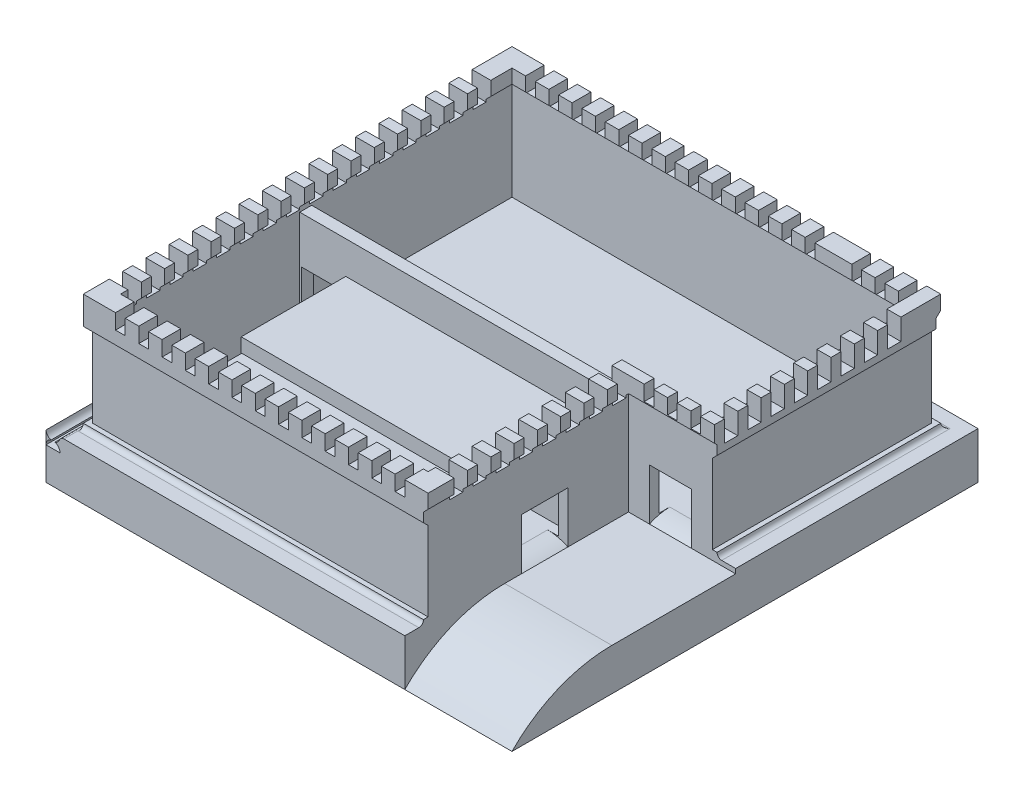
from build123d import *

# Parameters (mm, degrees)
SKETCH1_W                 = 100
SKETCH1_H                 = 100
BOSS_EXTRUDE1_DEPTH       = 10
BOSS_EXTRUDE2_DEPTH       = 20
CUT_EXTRUDE1_START        = -100
CUT_EXTRUDE1_DEPTH        = 100
CUT_EXTRUDE1_START_2      = -101
CUT_EXTRUDE1_2_DEPTH      = 102
SKETCH5_W                 = 9
SKETCH5_H                 = 10
CUT_EXTRUDE2_DEPTH        = 20
SKETCH6_W                 = 10
SKETCH6_H                 = 10
CUT_EXTRUDE3_DEPTH        = 20
BOSS_EXTRUDE3_DEPTH       = 1
FILLET1_R                 = 1
SKETCH8_W                 = 23
SKETCH8_H                 = 48
CUT_EXTRUDE4_DEPTH        = 1
FILLET2_R                 = 30
FILLET3_START             = 31.5
FILLET3_DEPTH             = 9
FILLET3_START_2           = 33.91668
FILLET3_2_DEPTH           = 9.08332
FILLET3_START_3           = 15
FILLET3_3_DEPTH           = 10
FILLET3_4_DEPTH           = 28
BOSS_EXTRUDE4_DEPTH       = 5
CHAMFER1_SIZE             = 2
CHAMFER2_SIZE             = 2
CHAMFER3_SIZE             = 2
CHAMFER4_SIZE             = 2
CUT_EXTRUDE5_DEPTH        = 114.758517518
CUT_EXTRUDE5_DEPTH_BACK   = 114.758517518
SKETCH11_W                = 2.088138395
SKETCH11_H                = 3.24599204
CUT_EXTRUDE6_DEPTH        = 114.758516165
CUT_EXTRUDE6_DEPTH_BACK   = 114.758516165
SKETCH12_W                = 2.852535489
SKETCH12_H                = 4.538038875
CUT_EXTRUDE7_DEPTH        = 114.758517518
CUT_EXTRUDE7_DEPTH_BACK   = 114.758517518
SKETCH13_W                = 2.088138395
SKETCH13_H                = 3.24599204
SKETCH14_W                = 68.165894697
SKETCH14_H                = 2.552820194
BOSS_EXTRUDE5_DEPTH       = 20
SKETCH15_W                = 10
SKETCH15_H                = 10
CUT_EXTRUDE8_DEPTH        = 20
EXTRUDE_THIN1_START       = -0.282202113
EXTRUDE_THIN1_OUTLINE_W   = 26.615026424
EXTRUDE_THIN1_OUTLINE_H   = 9
EXTRUDE_THIN1_OUTLINE_W_2 = 14
EXTRUDE_THIN1_DEPTH       = 10.282202113
SKETCH17_W                = 58.115026424
SKETCH17_H                = 22.447179806
BOSS_EXTRUDE6_DEPTH       = 3


with BuildPart() as part:
    # Sketch1 → Boss-Extrude1 (new body)
    with BuildSketch(Plane(origin=(0, 0, 0), x_dir=(1, 0, 0), z_dir=(0, 1, 0))):
        Rectangle(SKETCH1_W, SKETCH1_H)
    extrude(amount=BOSS_EXTRUDE1_DEPTH)

    # Sketch2 → Boss-Extrude2 (add)
    with BuildSketch(Plane(origin=(0, 10, 0), x_dir=(1, 0, 0), z_dir=(0, 1, 0))):
        Polygon((43, -2), (45, -2), (45, 0), (45, 45), (-45, 45), (-45, -45), (25, -45), (27, -45), (27, -43), (27, -2), align=None)
        Polygon((-43, 43), (43, 43), (43, 0), (25, 0), (25, -43), (-43, -43), align=None, mode=Mode.SUBTRACT)
    extrude(amount=BOSS_EXTRUDE2_DEPTH)

    # Cut-Extrude1 2 outline → Cut-Extrude1 2 (cut)
    with BuildSketch(Plane.XY.offset(50).offset(CUT_EXTRUDE1_START_2)):
        with BuildLine():
            ThreePointArc((-48.08454022, 8.427966545), (-47.26102105, 9.019950559), (-47, 10))
            Line((-47, 10), (-50, 10))
            Line((-50, 10), (-50, 6.983607237))
            Line((-50, 6.983607237), (-47, 6.983607237))
            ThreePointArc((-47, 6.983607237), (-47.300504275, 7.887323972), (-48.08454022, 8.427966545))
        make_face()
    extrude(amount=CUT_EXTRUDE1_2_DEPTH, mode=Mode.SUBTRACT)

    # Sketch5 → Cut-Extrude2 (cut)
    with BuildSketch(Plane.XY.offset(2)):
        with Locations((36, 15)):
            Rectangle(SKETCH5_W, SKETCH5_H)
    extrude(amount=-CUT_EXTRUDE2_DEPTH, mode=Mode.SUBTRACT)

    # Sketch6 → Cut-Extrude3 (cut)
    with BuildSketch(Plane(origin=(27, 0, 0), x_dir=(0, 0, -1), z_dir=(1, 0, 0))):
        with Locations((-20, 15)):
            Rectangle(SKETCH6_W, SKETCH6_H)
    extrude(amount=-CUT_EXTRUDE3_DEPTH, mode=Mode.SUBTRACT)

    # Sketch7 → Boss-Extrude3 (add)
    with BuildSketch(Plane(origin=(0, 10, 0), x_dir=(1, 0, 0), z_dir=(0, 1, 0))):
        Polygon((27, -46), (27, -45), (-45, -45), (-45, 45), (45, 45), (45, -2), (46, -2), (46, 46), (-46, 46), (-46, -46), align=None)
    extrude(amount=BOSS_EXTRUDE3_DEPTH)

    # Fillet1
    fillet1_edges = [part.edges().sort_by_distance(p)[0] for p in [
        (46, 10, -22),
        (0, 10, -46),
        (-47, 10, 0),
        (-9.5, 10, 46),
    ]]
    fillet(fillet1_edges, radius=FILLET1_R - 0.0001)  # a hair under: the kernel refuses the full size

    # Sketch8 → Cut-Extrude4 (cut)
    with BuildSketch(Plane(origin=(0, 10, 0), x_dir=(1, 0, 0), z_dir=(0, 1, 0))):
        with Locations((38.5, -26)):
            Rectangle(SKETCH8_W, SKETCH8_H)
    extrude(amount=-CUT_EXTRUDE4_DEPTH, mode=Mode.SUBTRACT)

    # Fillet2
    # the kernel refuses this fillet: 30 mm, written as the material it takes off along each edge
    with BuildSketch(Plane(origin=(103.560713214, 9, 50), x_dir=(0, -1, 0), z_dir=(-1, 0, 0))) as fillet2_piece_1:
        with BuildLine():
            CenterArc((30, -21.424285286), FILLET2_R, 134.427004001, 45.572995999)
            Line((0, -21.424285286), (-0.6, -21.424285286))
            Line((-0.6, -21.424285286), (-0.6, 0))
            Line((-0.6, 0), (0, 0.6))
            ThreePointArc((0, 0.6), (4.5, 0.6), (8.58, 0.428485706))
            Line((8.58, 0.428485706), (9, 0))
        make_face()
    extrude(amount=76.560713214, mode=Mode.SUBTRACT)

    # Fillet3: read off the stored shape, not the designer's step
    # Fillet3 outline → Fillet3 (cut)
    with BuildSketch(Plane.YZ.offset(FILLET3_START)):
        with BuildLine():
            Line((10, 2), (9, 2))
            ThreePointArc((9, 2), (9.746794345, -0.122830966), (10, -2.358898944))
            Line((10, -2.358898944), (10, 2))
        make_face()
    extrude(amount=FILLET3_DEPTH, mode=Mode.SUBTRACT)

    # Fillet3 2 outline → Fillet3 2 (cut)
    with BuildSketch(Plane.YZ.offset(FILLET3_START_2)):
        with BuildLine():
            Line((10, 0), (9.717797887, 0))
            ThreePointArc((9.717797887, 0), (9.929198832, -1.171039287), (10, -2.358898944))
            Line((10, -2.358898944), (10, 0))
        make_face()
    extrude(amount=FILLET3_2_DEPTH, mode=Mode.SUBTRACT)

    # Fillet3 3 outline → Fillet3 3 (cut)
    with BuildSketch(Plane.XY.offset(FILLET3_START_3)):
        with BuildLine():
            Line((27, 9), (27, 10))
            Line((27, 10), (22.641101056, 10))
            ThreePointArc((22.641101056, 10), (24.877169034, 9.746794345), (27, 9))
        make_face()
    extrude(amount=FILLET3_3_DEPTH, mode=Mode.SUBTRACT)

    # Fillet3 4 outline → Fillet3 4 (cut)
    with BuildSketch(Plane.XY.offset(FILLET3_START_3)):
        with BuildLine():
            ThreePointArc((22.641101056, 10), (23.828960713, 9.929198832), (25, 9.717797887))
            Line((25, 9.717797887), (25, 10))
            Line((25, 10), (22.641101056, 10))
        make_face()
    extrude(amount=FILLET3_4_DEPTH, mode=Mode.SUBTRACT)

    # Sketch10 → Boss-Extrude4 (add)
    with BuildSketch(Plane(origin=(0, 30, 0), x_dir=(1, 0, 0), z_dir=(0, 1, 0))):
        Polygon((28, -3), (46, -3), (46, 46), (-46, 46), (-46, -46), (28, -46), align=None)
        Polygon((24, 1), (42, 1), (42, 42), (-42, 42), (-42, -42), (24, -42), align=None, mode=Mode.SUBTRACT)
    extrude(amount=BOSS_EXTRUDE4_DEPTH)

    # Chamfer1
    # the kernel refuses this chamfer: 2 mm, written as the material it adds along each edge
    with BuildSketch(Plane(origin=(-45, 30, -45), x_dir=(-1, 0, 0), z_dir=(0, 0, 1))) as chamfer1_piece_1_section:
        Polygon((CHAMFER1_SIZE, 0), (0, CHAMFER1_SIZE), (0, 0), align=None)
    chamfer1_piece_1 = extrude(amount=90, mode=Mode.PRIVATE)
    chamfer1_piece_1 = split(chamfer1_piece_1, bisect_by=Plane(origin=(-46, 30, -45), z_dir=(1, 0, 0)), keep=Keep.TOP, mode=Mode.PRIVATE)
    add(chamfer1_piece_1)
    with BuildSketch(Plane(origin=(27, 30, 45), x_dir=(0, 0, 1), z_dir=(-1, 0, 0))) as chamfer1_piece_2_section:
        Polygon((CHAMFER1_SIZE, 0), (0, -CHAMFER1_SIZE), (0, 0), align=None)
    chamfer1_piece_2 = extrude(amount=72, mode=Mode.PRIVATE)
    chamfer1_piece_2 = split(chamfer1_piece_2, bisect_by=Plane(origin=(27, 30, 46), z_dir=(0, 0, -1)), keep=Keep.TOP, mode=Mode.PRIVATE)
    add(chamfer1_piece_2)
    with BuildSketch(Plane(origin=(45, 30, -45), x_dir=(1, 0, 0), z_dir=(0, 0, 1))) as chamfer1_piece_3_section:
        Polygon((CHAMFER1_SIZE, 0), (0, -CHAMFER1_SIZE), (0, 0), align=None)
    chamfer1_piece_3 = extrude(amount=47, mode=Mode.PRIVATE)
    chamfer1_piece_3 = split(chamfer1_piece_3, bisect_by=Plane(origin=(46, 30, -45), z_dir=(-1, 0, 0)), keep=Keep.TOP, mode=Mode.PRIVATE)
    add(chamfer1_piece_3)
    with BuildSketch(Plane(origin=(-45, 30, -45), x_dir=(-1, 0, 0), z_dir=(0, 0, 1))) as chamfer1_piece_4a_section:
        Polygon((CHAMFER1_SIZE, 0), (0, CHAMFER1_SIZE), (0, 0), align=None)
    chamfer1_piece_4a = extrude(amount=95.143365976, mode=Mode.PRIVATE)
    chamfer1_piece_4a = split(chamfer1_piece_4a, bisect_by=Plane(origin=(-45, 30, 46), z_dir=(0, 0, -1)), keep=Keep.TOP, mode=Mode.PRIVATE)
    chamfer1_piece_4a = split(chamfer1_piece_4a, bisect_by=Plane(origin=(-46, 30, -45), z_dir=(1, 0, 0)), keep=Keep.TOP, mode=Mode.PRIVATE)
    chamfer1_piece_4a = split(chamfer1_piece_4a, bisect_by=Plane(origin=(-45, 30, 45), z_dir=(0, 0, 1)), keep=Keep.TOP, mode=Mode.PRIVATE)
    with BuildSketch(Plane(origin=(27, 30, 45), x_dir=(0, 0, 1), z_dir=(-1, 0, 0))) as chamfer1_piece_4b_section:
        Polygon((CHAMFER1_SIZE, 0), (0, -CHAMFER1_SIZE), (0, 0), align=None)
    chamfer1_piece_4b = extrude(amount=77.143365976, mode=Mode.PRIVATE)
    chamfer1_piece_4b = split(chamfer1_piece_4b, bisect_by=Plane(origin=(27, 30, 46), z_dir=(0, 0, -1)), keep=Keep.TOP, mode=Mode.PRIVATE)
    chamfer1_piece_4b = split(chamfer1_piece_4b, bisect_by=Plane(origin=(-46, 30, 45), z_dir=(1, 0, 0)), keep=Keep.TOP, mode=Mode.PRIVATE)
    chamfer1_piece_4b = split(chamfer1_piece_4b, bisect_by=Plane(origin=(-45, 30, 45), z_dir=(-1, 0, 0)), keep=Keep.TOP, mode=Mode.PRIVATE)
    chamfer1_piece_4 = chamfer1_piece_4a & chamfer1_piece_4b
    add(chamfer1_piece_4)

    # Chamfer2
    # the kernel refuses this chamfer: 2 mm, written as the material it takes off along each edge
    with BuildSketch(Plane(origin=(51.143365976, 30, -46), x_dir=(0, 1, 0), z_dir=(-1, 0, 0))) as chamfer2_piece_1_section:
        Polygon((CHAMFER2_SIZE, 0), (0, -CHAMFER2_SIZE), (0, 0), align=None)
    chamfer2_piece_1 = extrude(amount=102.286731952, mode=Mode.PRIVATE)
    chamfer2_piece_1 = split(chamfer2_piece_1, bisect_by=Plane(origin=(51.143365976, 30, -45), z_dir=(0, 0, -1)), keep=Keep.TOP, mode=Mode.PRIVATE)
    add(chamfer2_piece_1, mode=Mode.SUBTRACT)
    with BuildSketch(Plane(origin=(28, 30, 3), x_dir=(0, 1, 0), z_dir=(1, 0, 0))) as chamfer2_piece_2_section:
        Polygon((CHAMFER2_SIZE, 0), (0, -CHAMFER2_SIZE), (0, 0), align=None)
    chamfer2_piece_2 = extrude(amount=23.143365976, mode=Mode.PRIVATE)
    chamfer2_piece_2 = split(chamfer2_piece_2, bisect_by=Plane(origin=(28, 30, 2), z_dir=(0, 0, 1)), keep=Keep.TOP, mode=Mode.PRIVATE)
    add(chamfer2_piece_2, mode=Mode.SUBTRACT)
    with BuildSketch(Plane(origin=(28, 30, 51.143365976), x_dir=(-1, 0, 0), z_dir=(0, 0, -1))) as chamfer2_piece_3_section:
        Polygon((CHAMFER2_SIZE, 0), (0, CHAMFER2_SIZE), (0, 0), align=None)
    chamfer2_piece_3 = extrude(amount=48.143365976, mode=Mode.PRIVATE)
    chamfer2_piece_3 = split(chamfer2_piece_3, bisect_by=Plane(origin=(27, 30, 51.143365976), z_dir=(1, 0, 0)), keep=Keep.TOP, mode=Mode.PRIVATE)
    add(chamfer2_piece_3, mode=Mode.SUBTRACT)
    with BuildSketch(Plane(origin=(22.856634024, 30, 3), x_dir=(0, 1, 0), z_dir=(1, 0, 0))) as chamfer2_piece_4a_section:
        Polygon((CHAMFER2_SIZE, 0), (0, -CHAMFER2_SIZE), (0, 0), align=None)
    chamfer2_piece_4a = extrude(amount=23.143365976, mode=Mode.PRIVATE)
    chamfer2_piece_4a = split(chamfer2_piece_4a, bisect_by=Plane(origin=(27, 30, 3), z_dir=(1, 0, 0)), keep=Keep.TOP, mode=Mode.PRIVATE)
    chamfer2_piece_4a = split(chamfer2_piece_4a, bisect_by=Plane(origin=(22.856634024, 30, 2), z_dir=(0, 0, 1)), keep=Keep.TOP, mode=Mode.PRIVATE)
    chamfer2_piece_4a = split(chamfer2_piece_4a, bisect_by=Plane(origin=(28, 30, 3), z_dir=(-1, 0, 0)), keep=Keep.TOP, mode=Mode.PRIVATE)
    with BuildSketch(Plane(origin=(28, 30, 46), x_dir=(-1, 0, 0), z_dir=(0, 0, -1))) as chamfer2_piece_4b_section:
        Polygon((CHAMFER2_SIZE, 0), (0, CHAMFER2_SIZE), (0, 0), align=None)
    chamfer2_piece_4b = extrude(amount=48.143365976, mode=Mode.PRIVATE)
    chamfer2_piece_4b = split(chamfer2_piece_4b, bisect_by=Plane(origin=(27, 30, 46), z_dir=(1, 0, 0)), keep=Keep.TOP, mode=Mode.PRIVATE)
    chamfer2_piece_4b = split(chamfer2_piece_4b, bisect_by=Plane(origin=(28, 30, 2), z_dir=(0, 0, 1)), keep=Keep.TOP, mode=Mode.PRIVATE)
    chamfer2_piece_4b = split(chamfer2_piece_4b, bisect_by=Plane(origin=(28, 30, 3), z_dir=(0, 0, -1)), keep=Keep.TOP, mode=Mode.PRIVATE)
    chamfer2_piece_4 = chamfer2_piece_4a & chamfer2_piece_4b
    add(chamfer2_piece_4, mode=Mode.SUBTRACT)

    # Chamfer3
    # the kernel refuses this chamfer: 2 mm, written as the material it takes off along each edge
    with BuildSketch(Plane(origin=(-42, 30, 42), x_dir=(0, 0, 1), z_dir=(1, 0, 0))) as chamfer3_piece_1_section:
        Polygon((CHAMFER3_SIZE, 0), (0, -CHAMFER3_SIZE), (0, 0), align=None)
    chamfer3_piece_1 = extrude(amount=66, mode=Mode.PRIVATE)
    chamfer3_piece_1 = split(chamfer3_piece_1, bisect_by=Plane(origin=(-42, 30, 43), z_dir=(0, 0, -1)), keep=Keep.TOP, mode=Mode.PRIVATE)
    add(chamfer3_piece_1, mode=Mode.SUBTRACT)
    with BuildSketch(Plane(origin=(18.856634024, 30, -1), x_dir=(0, 1, 0), z_dir=(1, 0, 0))) as chamfer3_piece_2_section:
        Polygon((CHAMFER3_SIZE, 0), (0, CHAMFER3_SIZE), (0, 0), align=None)
    chamfer3_piece_2 = extrude(amount=23.143365976, mode=Mode.PRIVATE)
    chamfer3_piece_2 = split(chamfer3_piece_2, bisect_by=Plane(origin=(18.856634024, 30, 0), z_dir=(0, 0, -1)), keep=Keep.TOP, mode=Mode.PRIVATE)
    add(chamfer3_piece_2, mode=Mode.SUBTRACT)
    with BuildSketch(Plane(origin=(18.856634024, 30, -1), x_dir=(0, 1, 0), z_dir=(1, 0, 0))) as chamfer3_piece_3_section:
        Polygon((CHAMFER3_SIZE, 0), (0, CHAMFER3_SIZE), (0, 0), align=None)
    chamfer3_piece_3 = extrude(amount=28.286731952, mode=Mode.PRIVATE)
    chamfer3_piece_3 = split(chamfer3_piece_3, bisect_by=Plane(origin=(25, 30, -1), z_dir=(-1, 0, 0)), keep=Keep.TOP, mode=Mode.PRIVATE)
    add(chamfer3_piece_3, mode=Mode.SUBTRACT)
    with BuildSketch(Plane(origin=(42, 30, -1), x_dir=(1, 0, 0), z_dir=(0, 0, -1))) as chamfer3_piece_4_section:
        Polygon((CHAMFER3_SIZE, 0), (0, -CHAMFER3_SIZE), (0, 0), align=None)
    chamfer3_piece_4 = extrude(amount=41, mode=Mode.PRIVATE)
    chamfer3_piece_4 = split(chamfer3_piece_4, bisect_by=Plane(origin=(43, 30, -1), z_dir=(-1, 0, 0)), keep=Keep.TOP, mode=Mode.PRIVATE)
    add(chamfer3_piece_4, mode=Mode.SUBTRACT)
    with BuildSketch(Plane(origin=(42, 30, -42), x_dir=(0, 0, -1), z_dir=(-1, 0, 0))) as chamfer3_piece_5_section:
        Polygon((CHAMFER3_SIZE, 0), (0, -CHAMFER3_SIZE), (0, 0), align=None)
    chamfer3_piece_5 = extrude(amount=84, mode=Mode.PRIVATE)
    chamfer3_piece_5 = split(chamfer3_piece_5, bisect_by=Plane(origin=(42, 30, -43), z_dir=(0, 0, 1)), keep=Keep.TOP, mode=Mode.PRIVATE)
    add(chamfer3_piece_5, mode=Mode.SUBTRACT)
    with BuildSketch(Plane(origin=(-42, 30, -42), x_dir=(-1, 0, 0), z_dir=(0, 0, 1))) as chamfer3_piece_6_section:
        Polygon((CHAMFER3_SIZE, 0), (0, -CHAMFER3_SIZE), (0, 0), align=None)
    chamfer3_piece_6 = extrude(amount=84, mode=Mode.PRIVATE)
    chamfer3_piece_6 = split(chamfer3_piece_6, bisect_by=Plane(origin=(-43, 30, -42), z_dir=(1, 0, 0)), keep=Keep.TOP, mode=Mode.PRIVATE)
    add(chamfer3_piece_6, mode=Mode.SUBTRACT)
    with BuildSketch(Plane(origin=(-47.143365976, 30, 42), x_dir=(0, 0, 1), z_dir=(1, 0, 0))) as chamfer3_piece_7a_section:
        Polygon((CHAMFER3_SIZE, 0), (0, -CHAMFER3_SIZE), (0, 0), align=None)
    chamfer3_piece_7a = extrude(amount=71.143365976, mode=Mode.PRIVATE)
    chamfer3_piece_7a = split(chamfer3_piece_7a, bisect_by=Plane(origin=(-47.143365976, 30, 43), z_dir=(0, 0, -1)), keep=Keep.TOP, mode=Mode.PRIVATE)
    chamfer3_piece_7a = split(chamfer3_piece_7a, bisect_by=Plane(origin=(-43, 30, 42), z_dir=(1, 0, 0)), keep=Keep.TOP, mode=Mode.PRIVATE)
    chamfer3_piece_7a = split(chamfer3_piece_7a, bisect_by=Plane(origin=(-42, 30, 42), z_dir=(-1, 0, 0)), keep=Keep.TOP, mode=Mode.PRIVATE)
    with BuildSketch(Plane(origin=(-42, 30, -42), x_dir=(-1, 0, 0), z_dir=(0, 0, 1))) as chamfer3_piece_7b_section:
        Polygon((CHAMFER3_SIZE, 0), (0, -CHAMFER3_SIZE), (0, 0), align=None)
    chamfer3_piece_7b = extrude(amount=89.143365976, mode=Mode.PRIVATE)
    chamfer3_piece_7b = split(chamfer3_piece_7b, bisect_by=Plane(origin=(-42, 30, 43), z_dir=(0, 0, -1)), keep=Keep.TOP, mode=Mode.PRIVATE)
    chamfer3_piece_7b = split(chamfer3_piece_7b, bisect_by=Plane(origin=(-43, 30, -42), z_dir=(1, 0, 0)), keep=Keep.TOP, mode=Mode.PRIVATE)
    chamfer3_piece_7b = split(chamfer3_piece_7b, bisect_by=Plane(origin=(-42, 30, 42), z_dir=(0, 0, 1)), keep=Keep.TOP, mode=Mode.PRIVATE)
    chamfer3_piece_7 = chamfer3_piece_7a & chamfer3_piece_7b
    add(chamfer3_piece_7, mode=Mode.SUBTRACT)
    with BuildSketch(Plane(origin=(24, 30, -1), x_dir=(0, 1, 0), z_dir=(1, 0, 0))) as chamfer3_piece_8a_section:
        Polygon((CHAMFER3_SIZE, 0), (0, CHAMFER3_SIZE), (0, 0), align=None)
    chamfer3_piece_8a = extrude(amount=23.143365976, mode=Mode.PRIVATE)
    chamfer3_piece_8a = split(chamfer3_piece_8a, bisect_by=Plane(origin=(24, 30, 0), z_dir=(0, 0, -1)), keep=Keep.TOP, mode=Mode.PRIVATE)
    chamfer3_piece_8a = split(chamfer3_piece_8a, bisect_by=Plane(origin=(43, 30, -1), z_dir=(-1, 0, 0)), keep=Keep.TOP, mode=Mode.PRIVATE)
    chamfer3_piece_8a = split(chamfer3_piece_8a, bisect_by=Plane(origin=(42, 30, -1), z_dir=(1, 0, 0)), keep=Keep.TOP, mode=Mode.PRIVATE)
    with BuildSketch(Plane(origin=(42, 30, 4.143365976), x_dir=(1, 0, 0), z_dir=(0, 0, -1))) as chamfer3_piece_8b_section:
        Polygon((CHAMFER3_SIZE, 0), (0, -CHAMFER3_SIZE), (0, 0), align=None)
    chamfer3_piece_8b = extrude(amount=46.143365976, mode=Mode.PRIVATE)
    chamfer3_piece_8b = split(chamfer3_piece_8b, bisect_by=Plane(origin=(42, 30, -1), z_dir=(0, 0, 1)), keep=Keep.TOP, mode=Mode.PRIVATE)
    chamfer3_piece_8b = split(chamfer3_piece_8b, bisect_by=Plane(origin=(42, 30, 0), z_dir=(0, 0, -1)), keep=Keep.TOP, mode=Mode.PRIVATE)
    chamfer3_piece_8b = split(chamfer3_piece_8b, bisect_by=Plane(origin=(43, 30, 4.143365976), z_dir=(-1, 0, 0)), keep=Keep.TOP, mode=Mode.PRIVATE)
    chamfer3_piece_8 = chamfer3_piece_8a & chamfer3_piece_8b
    add(chamfer3_piece_8, mode=Mode.SUBTRACT)
    with BuildSketch(Plane(origin=(42, 30, -1), x_dir=(1, 0, 0), z_dir=(0, 0, -1))) as chamfer3_piece_9a_section:
        Polygon((CHAMFER3_SIZE, 0), (0, -CHAMFER3_SIZE), (0, 0), align=None)
    chamfer3_piece_9a = extrude(amount=46.143365976, mode=Mode.PRIVATE)
    chamfer3_piece_9a = split(chamfer3_piece_9a, bisect_by=Plane(origin=(43, 30, -1), z_dir=(-1, 0, 0)), keep=Keep.TOP, mode=Mode.PRIVATE)
    chamfer3_piece_9a = split(chamfer3_piece_9a, bisect_by=Plane(origin=(42, 30, -43), z_dir=(0, 0, 1)), keep=Keep.TOP, mode=Mode.PRIVATE)
    chamfer3_piece_9a = split(chamfer3_piece_9a, bisect_by=Plane(origin=(42, 30, -42), z_dir=(0, 0, -1)), keep=Keep.TOP, mode=Mode.PRIVATE)
    with BuildSketch(Plane(origin=(47.143365976, 30, -42), x_dir=(0, 0, -1), z_dir=(-1, 0, 0))) as chamfer3_piece_9b_section:
        Polygon((CHAMFER3_SIZE, 0), (0, -CHAMFER3_SIZE), (0, 0), align=None)
    chamfer3_piece_9b = extrude(amount=89.143365976, mode=Mode.PRIVATE)
    chamfer3_piece_9b = split(chamfer3_piece_9b, bisect_by=Plane(origin=(43, 30, -42), z_dir=(-1, 0, 0)), keep=Keep.TOP, mode=Mode.PRIVATE)
    chamfer3_piece_9b = split(chamfer3_piece_9b, bisect_by=Plane(origin=(47.143365976, 30, -43), z_dir=(0, 0, 1)), keep=Keep.TOP, mode=Mode.PRIVATE)
    chamfer3_piece_9b = split(chamfer3_piece_9b, bisect_by=Plane(origin=(42, 30, -42), z_dir=(1, 0, 0)), keep=Keep.TOP, mode=Mode.PRIVATE)
    chamfer3_piece_9 = chamfer3_piece_9a & chamfer3_piece_9b
    add(chamfer3_piece_9, mode=Mode.SUBTRACT)
    with BuildSketch(Plane(origin=(-42, 30, -47.143365976), x_dir=(-1, 0, 0), z_dir=(0, 0, 1))) as chamfer3_piece_10a_section:
        Polygon((CHAMFER3_SIZE, 0), (0, -CHAMFER3_SIZE), (0, 0), align=None)
    chamfer3_piece_10a = extrude(amount=89.143365976, mode=Mode.PRIVATE)
    chamfer3_piece_10a = split(chamfer3_piece_10a, bisect_by=Plane(origin=(-42, 30, -43), z_dir=(0, 0, 1)), keep=Keep.TOP, mode=Mode.PRIVATE)
    chamfer3_piece_10a = split(chamfer3_piece_10a, bisect_by=Plane(origin=(-43, 30, -47.143365976), z_dir=(1, 0, 0)), keep=Keep.TOP, mode=Mode.PRIVATE)
    chamfer3_piece_10a = split(chamfer3_piece_10a, bisect_by=Plane(origin=(-42, 30, -42), z_dir=(0, 0, -1)), keep=Keep.TOP, mode=Mode.PRIVATE)
    with BuildSketch(Plane(origin=(42, 30, -42), x_dir=(0, 0, -1), z_dir=(-1, 0, 0))) as chamfer3_piece_10b_section:
        Polygon((CHAMFER3_SIZE, 0), (0, -CHAMFER3_SIZE), (0, 0), align=None)
    chamfer3_piece_10b = extrude(amount=89.143365976, mode=Mode.PRIVATE)
    chamfer3_piece_10b = split(chamfer3_piece_10b, bisect_by=Plane(origin=(42, 30, -43), z_dir=(0, 0, 1)), keep=Keep.TOP, mode=Mode.PRIVATE)
    chamfer3_piece_10b = split(chamfer3_piece_10b, bisect_by=Plane(origin=(-43, 30, -42), z_dir=(1, 0, 0)), keep=Keep.TOP, mode=Mode.PRIVATE)
    chamfer3_piece_10b = split(chamfer3_piece_10b, bisect_by=Plane(origin=(-42, 30, -42), z_dir=(-1, 0, 0)), keep=Keep.TOP, mode=Mode.PRIVATE)
    chamfer3_piece_10 = chamfer3_piece_10a & chamfer3_piece_10b
    add(chamfer3_piece_10, mode=Mode.SUBTRACT)

    # Chamfer4
    # the kernel refuses this chamfer: 2 mm, written as the material it takes off along each edge
    with BuildSketch(Plane(origin=(24, 30, -4.143365976), x_dir=(1, 0, 0), z_dir=(0, 0, 1))) as chamfer4_piece_1_section:
        Polygon((CHAMFER4_SIZE, 0), (0, CHAMFER4_SIZE), (0, 0), align=None)
    chamfer4_piece_1 = extrude(amount=47.143365976, mode=Mode.PRIVATE)
    chamfer4_piece_1 = split(chamfer4_piece_1, bisect_by=Plane(origin=(25, 30, -4.143365976), z_dir=(-1, 0, 0)), keep=Keep.TOP, mode=Mode.PRIVATE)
    chamfer4_piece_1 = split(chamfer4_piece_1, bisect_by=Plane(origin=(24, 54.071682988, 19.928317012), z_dir=(0, -0.7071067811865476, -0.7071067811865476)), keep=Keep.TOP, mode=Mode.PRIVATE)
    add(chamfer4_piece_1, mode=Mode.SUBTRACT)

    # Sketch11 → Cut-Extrude5 (cut, two sides: drawn at the far end of the back side and taken through both)
    with BuildSketch(Plane.XY.offset(46).offset(-CUT_EXTRUDE5_DEPTH_BACK)):
        with Locations((-38.044069198, 33.37700398)):
            Rectangle(SKETCH11_W, SKETCH11_H)
        with Locations((-33.044069198, 33.37700398)):
            Rectangle(SKETCH11_W, SKETCH11_H)
        with Locations((-28.044069198, 33.37700398)):
            Rectangle(SKETCH11_W, SKETCH11_H)
        with Locations((-23.044069198, 33.37700398)):
            Rectangle(SKETCH11_W, SKETCH11_H)
        with Locations((-18.044069198, 33.37700398)):
            Rectangle(SKETCH11_W, SKETCH11_H)
        with Locations((-13.044069198, 33.37700398)):
            Rectangle(SKETCH11_W, SKETCH11_H)
        with Locations((-8.044069198, 33.37700398)):
            Rectangle(SKETCH11_W, SKETCH11_H)
        with Locations((-3.044069198, 33.37700398)):
            Rectangle(SKETCH11_W, SKETCH11_H)
        with Locations((1.955930802, 33.37700398)):
            Rectangle(SKETCH11_W, SKETCH11_H)
        with Locations((6.955930803, 33.37700398)):
            Rectangle(SKETCH11_W, SKETCH11_H)
        with Locations((11.955930802, 33.37700398)):
            Rectangle(SKETCH11_W, SKETCH11_H)
        with Locations((21.955930802, 33.37700398)):
            Rectangle(SKETCH11_W, SKETCH11_H)
        with Locations((16.955930802, 33.37700398)):
            Rectangle(SKETCH11_W, SKETCH11_H)
    extrude(amount=CUT_EXTRUDE5_DEPTH + CUT_EXTRUDE5_DEPTH_BACK, mode=Mode.SUBTRACT)

    # Sketch12 → Cut-Extrude6 (cut, two sides: drawn at the far end of the back side and taken through both)
    with BuildSketch(Plane.ZY.offset(46).offset(-CUT_EXTRUDE6_DEPTH_BACK)):
        with Locations((33.979087939, 32.730980563)):
            Rectangle(SKETCH12_W, SKETCH12_H)
        with Locations((38.979087939, 32.730980563)):
            Rectangle(SKETCH12_W, SKETCH12_H)
        with Locations((28.979087939, 32.730980563)):
            Rectangle(SKETCH12_W, SKETCH12_H)
        with Locations((23.979087939, 32.730980563)):
            Rectangle(SKETCH12_W, SKETCH12_H)
        with Locations((18.979087939, 32.730980563)):
            Rectangle(SKETCH12_W, SKETCH12_H)
        with Locations((13.979087939, 32.730980563)):
            Rectangle(SKETCH12_W, SKETCH12_H)
        with Locations((8.979087939, 32.730980563)):
            Rectangle(SKETCH12_W, SKETCH12_H)
        with Locations((3.979087939, 32.730980563)):
            Rectangle(SKETCH12_W, SKETCH12_H)
        with Locations((-1.020912062, 32.730980563)):
            Rectangle(SKETCH12_W, SKETCH12_H)
        with Locations((-6.020912062, 32.730980563)):
            Rectangle(SKETCH12_W, SKETCH12_H)
        with Locations((-11.020912062, 32.730980563)):
            Rectangle(SKETCH12_W, SKETCH12_H)
        with Locations((-16.020912061, 32.730980563)):
            Rectangle(SKETCH12_W, SKETCH12_H)
        with Locations((-21.020912061, 32.730980563)):
            Rectangle(SKETCH12_W, SKETCH12_H)
        with Locations((-26.020912061, 32.730980563)):
            Rectangle(SKETCH12_W, SKETCH12_H)
        with Locations((-31.020912061, 32.730980563)):
            Rectangle(SKETCH12_W, SKETCH12_H)
        with Locations((-36.020912061, 32.730980563)):
            Rectangle(SKETCH12_W, SKETCH12_H)
    extrude(amount=CUT_EXTRUDE6_DEPTH + CUT_EXTRUDE6_DEPTH_BACK, mode=Mode.SUBTRACT)

    # Sketch13 → Cut-Extrude7 (cut, two sides: drawn at the far end of the back side and taken through both)
    with BuildSketch(Plane(origin=(0, 0, -46), x_dir=(-1, 0, 0), z_dir=(0, 0, -1)).offset(-CUT_EXTRUDE7_DEPTH_BACK)):
        with Locations((-21.955930802, 33.37700398)):
            Rectangle(SKETCH13_W, SKETCH13_H)
        with Locations((-31.955930802, 33.37700398)):
            Rectangle(SKETCH13_W, SKETCH13_H)
        with Locations((-36.955930803, 33.37700398)):
            Rectangle(SKETCH13_W, SKETCH13_H)
        with Locations((-41.955930803, 33.37700398)):
            Rectangle(SKETCH13_W, SKETCH13_H)
    extrude(amount=CUT_EXTRUDE7_DEPTH + CUT_EXTRUDE7_DEPTH_BACK, mode=Mode.SUBTRACT)

    # Sketch14 → Boss-Extrude5 (add)
    with BuildSketch(Plane(origin=(0, 10, 0), x_dir=(1, 0, 0), z_dir=(0, 1, 0))):
        with Locations((-9.082947349, -1.276410097)):
            Rectangle(SKETCH14_W, SKETCH14_H)
    extrude(amount=BOSS_EXTRUDE5_DEPTH)

    # Sketch15 → Cut-Extrude8 (cut)
    with BuildSketch(Plane.XY.offset(2.552820194)):
        with Locations((-37.615026424, 15)):
            Rectangle(SKETCH15_W, SKETCH15_H)
    extrude(amount=-CUT_EXTRUDE8_DEPTH, mode=Mode.SUBTRACT)

    # Extrude-Thin1: read off the stored shape, not the designer's step
    # Extrude-Thin1 outline → Extrude-Thin1 (add)
    with BuildSketch(Plane(origin=(0, 10, 0), x_dir=(1, 0, 0), z_dir=(0, 1, 0)).offset(EXTRUDE_THIN1_START)):
        Polygon((-32.615026424, -2.552820194), (-32.615026424, -2.052820194), (-33.115026424, -2.052820194), (-33.115026424, -13.052820194), (25, -13.052820194), (25, -2.552820194), align=None)
        with Locations((11.192486788, -7.552820194)):
            Rectangle(EXTRUDE_THIN1_OUTLINE_W, EXTRUDE_THIN1_OUTLINE_H, mode=Mode.SUBTRACT)
        with Locations((-25.115026424, -7.552820194)):
            Rectangle(EXTRUDE_THIN1_OUTLINE_W_2, EXTRUDE_THIN1_OUTLINE_H, mode=Mode.SUBTRACT)
        with Locations((-10.115026424, -7.552820194)):
            Rectangle(EXTRUDE_THIN1_OUTLINE_W_2, EXTRUDE_THIN1_OUTLINE_H, mode=Mode.SUBTRACT)
    extrude(amount=EXTRUDE_THIN1_DEPTH)

    # Sketch17 → Boss-Extrude6 (add)
    with BuildSketch(Plane(origin=(0, 20, 0), x_dir=(1, 0, 0), z_dir=(0, 1, 0))):
        with Locations((-4.057513212, -13.776410097)):
            Rectangle(SKETCH17_W, SKETCH17_H)
    extrude(amount=BOSS_EXTRUDE6_DEPTH)


with BuildPart() as body_2:
    # Cut-Extrude1: read off the stored shape, not the designer's step
    # Cut-Extrude1 outline → Cut-Extrude1 (new body)
    with BuildSketch(Plane.XY.offset(50).offset(CUT_EXTRUDE1_START)):
        with BuildLine():
            ThreePointArc((-50.00000308, 6.986646868), (-49.698582535, 7.888538849), (-48.91545978, 8.427966545))
            ThreePointArc((-48.91545978, 8.427966545), (-49.663536202, 8.91979403), (-50, 9.749435351))
            Line((-50, 9.749435351), (-50.00000308, 6.986646868))
        make_face()
    extrude(amount=CUT_EXTRUDE1_DEPTH)


solid = Compound([part.part, body_2.part])
